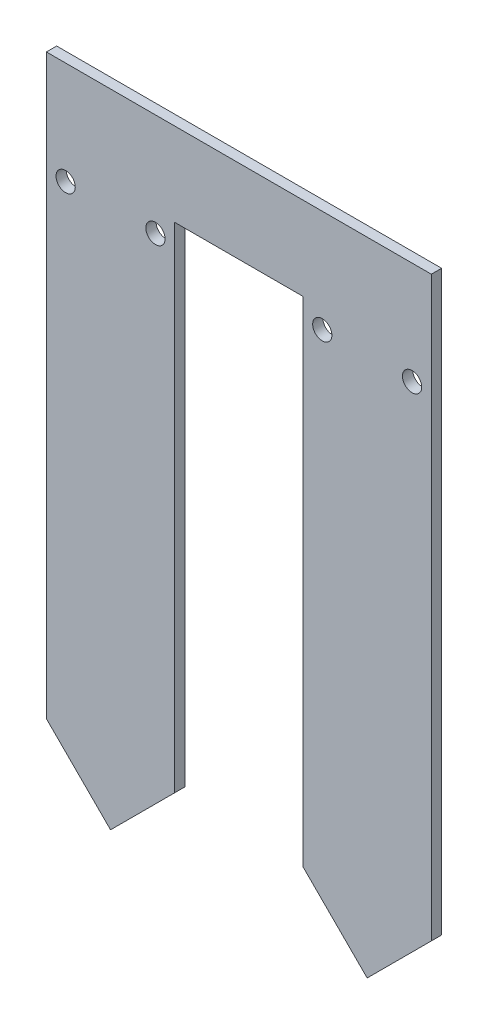
from build123d import *

# Parameters (mm, degrees)
IZIM1_R                     = 1.5
Y_KSEKLIK_EKSTR_ZYON1_DEPTH = 1.6


with BuildPart() as part:
    # Çizim1 → Yükseklik-Ekstrüzyon1 (new body)
    with BuildSketch(Plane.XY):
        Polygon((0, -55), (-10, -45), (-10, 45), (10, 45), (50, 45), (50, -45), (40, -55), (30, -45), (30, 32), (10, 32), (10, -45), align=None)
        with Locations((-7, 29)):
            Circle(IZIM1_R, mode=Mode.SUBTRACT)
        with Locations((7, 29)):
            Circle(IZIM1_R, mode=Mode.SUBTRACT)
        with Locations((33, 29)):
            Circle(IZIM1_R, mode=Mode.SUBTRACT)
        with Locations((47, 29)):
            Circle(IZIM1_R, mode=Mode.SUBTRACT)
    extrude(amount=Y_KSEKLIK_EKSTR_ZYON1_DEPTH)


solid = part.part
